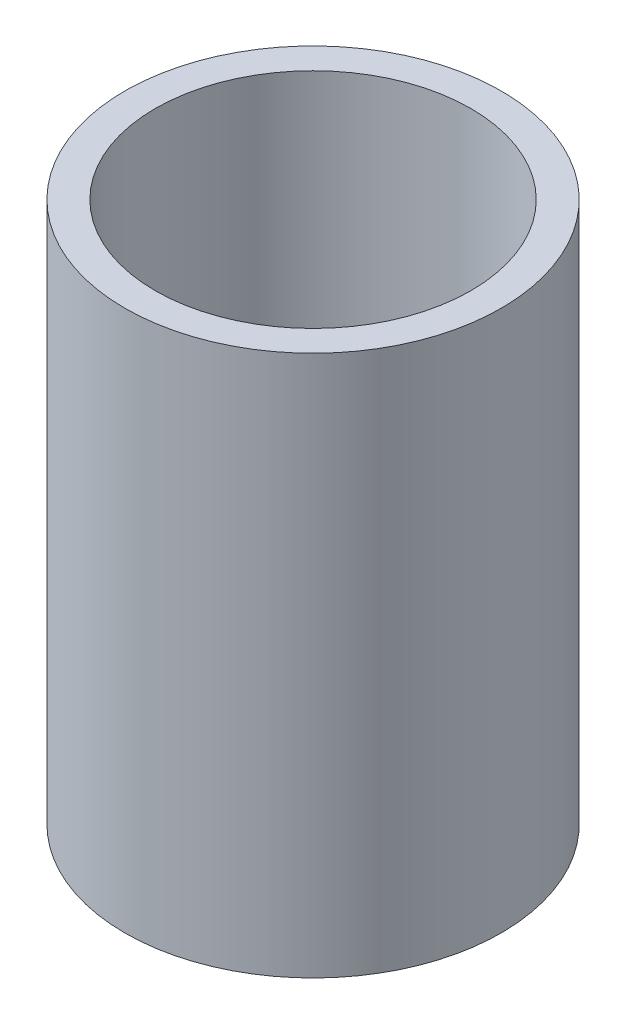
from build123d import *

# Parameters (mm, degrees)
SKETCH1_R           = 17.5
BOSS_EXTRUDE1_DEPTH = 50.310887299
SKETCH2_R           = 14.676112529
CUT_EXTRUDE1_DEPTH  = 57.068577481


with BuildPart() as part:
    # Sketch1 → Boss-Extrude1 (new body)
    with BuildSketch(Plane(origin=(0, 0, 0), x_dir=(1, 0, 0), z_dir=(0, 1, 0))):
        Circle(SKETCH1_R)
    extrude(amount=BOSS_EXTRUDE1_DEPTH)

    # Sketch2 → Cut-Extrude1 (cut, through all)
    with BuildSketch(Plane(origin=(0, 0, 0), x_dir=(1, 0, 0), z_dir=(0, 1, 0))):
        Circle(SKETCH2_R)
    extrude(amount=CUT_EXTRUDE1_DEPTH, mode=Mode.SUBTRACT)


solid = part.part
